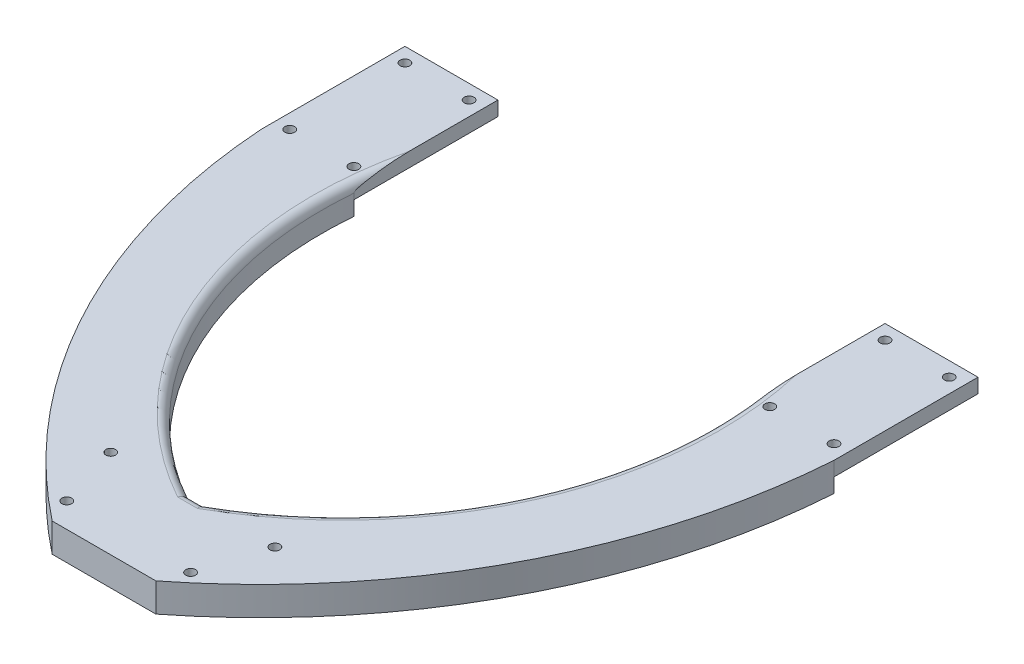
from build123d import *

# Parameters (mm, degrees)
SKIZZE1_W                        = 199
SKIZZE1_H                        = 420
AUFSATZ_LINEAR_AUSTRAGEN1_DEPTH  = 10
SKIZZE5_W                        = 199
SKIZZE5_H                        = 85
SCHNITT_LINEAR_AUSTRAGEN2_DEPTH  = 10
SKIZZE20_R                       = 1.7
SCHNITT_LINEAR_AUSTRAGEN12_DEPTH = 233.594604409
SKIZZE21_W                       = 134.422077922
SKIZZE21_H                       = 75
SCHNITT_LINEAR_AUSTRAGEN13_DEPTH = 233.594604409
SCHNITT_LINEAR_AUSTRAGEN14_DEPTH = 233.594604409
AUFSATZ_LINEAR_AUSTRAGEN6_DEPTH  = 10
SKIZZE25_R                       = 1.7
SCHNITT_LINEAR_AUSTRAGEN15_DEPTH = 233.594604409
SCHNITT_LINEAR_AUSTRAGEN16_DEPTH = 290.484023739
VERRUNDUNG1_R                    = 3
SKIZZE27_R                       = 1.7
SCHNITT_LINEAR_AUSTRAGEN17_DEPTH = 233.594604409
SCHNITT_LINEAR_AUSTRAGEN18_DEPTH = 5


with BuildPart() as part:
    # Skizze1 → Aufsatz-Linear austragen1 (new body)
    with BuildSketch(Plane(origin=(0, 0, 0), x_dir=(1, 0, 0), z_dir=(0, 1, 0))):
        Rectangle(SKIZZE1_W, SKIZZE1_H)
    extrude(amount=AUFSATZ_LINEAR_AUSTRAGEN1_DEPTH)

    # Skizze5 → Schnitt-Linear austragen2 (cut)
    with BuildSketch(Plane(origin=(0, 10, 0), x_dir=(1, 0, 0), z_dir=(0, 1, 0))):
        Polygon((99.5, -210), (18, -210), (99.5, -56), align=None)
        Polygon((-18, -210), (-99.5, -56), (-99.5, -210), align=None)
        with Locations((0, 167.5)):
            Rectangle(SKIZZE5_W, SKIZZE5_H)
        Polygon((67.211038961, -56), (-67.211038961, -56), (-2.646103896, -178), (2.646103896, -178), align=None)
    extrude(amount=-SCHNITT_LINEAR_AUSTRAGEN2_DEPTH, mode=Mode.SUBTRACT)

    # Skizze20 → Schnitt-Linear austragen12 (cut, through all)
    with BuildSketch(Plane(origin=(0, 10, 0), x_dir=(1, 0, 0), z_dir=(0, 1, 0))):
        with Locations(Location((90.5, 119.52, 0), (0, 0, 270))):
            Circle(SKIZZE20_R)
        with Locations(Location((48.5, 119.52, 0), (0, 0, 270))):
            Circle(SKIZZE20_R)
        with Locations(Location((-48.5, 119.52, 0), (0, 0, 90))):
            Circle(SKIZZE20_R)
        with Locations(Location((-90.5, 119.52, 0), (0, 0, 90))):
            Circle(SKIZZE20_R)
        with Locations(Location((87, 43.82, 0), (0, 0, 270))):
            Circle(SKIZZE20_R)
        with Locations(Location((52, 43.82, 0), (0, 0, 270))):
            Circle(SKIZZE20_R)
        with Locations(Location((-87, 43.82, 0), (0, 0, 90))):
            Circle(SKIZZE20_R)
        with Locations(Location((-52, 43.82, 0), (0, 0, 90))):
            Circle(SKIZZE20_R)
    extrude(amount=-SCHNITT_LINEAR_AUSTRAGEN12_DEPTH, mode=Mode.SUBTRACT)

    # Skizze21 → Schnitt-Linear austragen13 (cut, through all)
    with BuildSketch(Plane(origin=(0, 10, 0), x_dir=(1, 0, 0), z_dir=(0, 1, 0))):
        with Locations((0, -18.5)):
            Rectangle(SKIZZE21_W, SKIZZE21_H)
    extrude(amount=-SCHNITT_LINEAR_AUSTRAGEN13_DEPTH, mode=Mode.SUBTRACT)

    # Skizze22 → Schnitt-Linear austragen14 (cut, through all)
    with BuildSketch(Plane(origin=(0, 10, 0), x_dir=(1, 0, 0), z_dir=(0, 1, 0))):
        with BuildLine():
            Line((-67.211038961, -56), (-2.646103896, -178))
            ThreePointArc((-2.646103896, -178), (-52.825886854, -126.471631215), (-67.211038961, -56))
        make_face()
    schnitt_linear_austragen14 = extrude(amount=-SCHNITT_LINEAR_AUSTRAGEN14_DEPTH, mode=Mode.SUBTRACT)

    # Skizze23 → Aufsatz-Linear austragen6 (add)
    with BuildSketch(Plane(origin=(0, 10, 0), x_dir=(1, 0, 0), z_dir=(0, 1, 0))):
        with BuildLine():
            Line((-99.5, -56), (-18, -210))
            ThreePointArc((-18, -210), (-75.095260266, -141.650251374), (-99.5, -56))
        make_face()
    aufsatz_linear_austragen6 = extrude(amount=-AUFSATZ_LINEAR_AUSTRAGEN6_DEPTH)

    # Spiegeln2: Schnitt-Linear austragen14, Aufsatz-Linear austragen6 across plane
    add(schnitt_linear_austragen14.mirror(Plane(origin=(0, 0, 0), x_dir=(0, 0, 1), z_dir=(1, 0, 0))), mode=Mode.SUBTRACT)
    add(aufsatz_linear_austragen6.mirror(Plane(origin=(0, 0, 0), x_dir=(0, 0, 1), z_dir=(1, 0, 0))))

    # Skizze25 → Schnitt-Linear austragen15 (cut, through all)
    with BuildSketch(Plane(origin=(0, 10, 0), x_dir=(1, 0, 0), z_dir=(0, 1, 0))):
        with Locations(Location((-94.5, -11, 0), (0, 0, 270))):
            Circle(SKIZZE25_R)
        with Locations(Location((-72.211038961, -11, 0), (0, 0, 90))):
            Circle(SKIZZE25_R)
        with Locations(Location((-72.211038961, -51, 0), (0, 0, 270))):
            Circle(SKIZZE25_R)
        with Locations(Location((-94.5, -51, 0), (0, 0, 90))):
            Circle(SKIZZE25_R)
    schnitt_linear_austragen15 = extrude(amount=-SCHNITT_LINEAR_AUSTRAGEN15_DEPTH, mode=Mode.SUBTRACT)

    # Spiegeln3: Schnitt-Linear austragen15 across plane
    add(schnitt_linear_austragen15.mirror(Plane(origin=(0, 0, 0), x_dir=(0, 0, 1), z_dir=(1, 0, 0))), mode=Mode.SUBTRACT)

    # Skizze26 → Schnitt-Linear austragen16 (cut, through all)
    with BuildSketch(Plane.ZY.offset(99.5)):
        Polygon((56, 5), (56, 0), (4.196805737, -14.401746423), (-137.707729511, -14.401746423), (-137.707729511, 19.508660812), (5.012761814, 19.508660812), (6, 10), (6, 5), align=None)
    extrude(amount=-SCHNITT_LINEAR_AUSTRAGEN16_DEPTH, mode=Mode.SUBTRACT)

    # Verrundung1
    # the kernel refuses this fillet: 3 mm, written as the material it takes off along each edge
    with BuildSketch(Plane(origin=(60.076908998, 10, 66.721125619), x_dir=(-0.4390500946900349, 0, 0.8984625837243705), z_dir=(0.8984625837243705, 0, 0.4390500946900349))) as verrundung1_piece_1_section:
        with BuildLine():
            CenterArc((127.738655974 + VERRUNDUNG1_R, VERRUNDUNG1_R), VERRUNDUNG1_R, 180, 90)
            Line((127.738655974, VERRUNDUNG1_R), (127.738655974, 0))
            Line((127.738655974, 0), (127.738655974 + VERRUNDUNG1_R, 0))
        make_face()
    verrundung1_piece_1 = revolve(axis=Axis((60.076908998, 10, 66.721125619), (0, -1, 0)), revolution_arc=78.865488706, mode=Mode.PRIVATE)
    verrundung1_piece_1 = split(verrundung1_piece_1, bisect_by=Plane(origin=(60.076908998, 10, 178), z_dir=(0, 0, -1)), keep=Keep.TOP, mode=Mode.PRIVATE)
    add(verrundung1_piece_1, mode=Mode.SUBTRACT)
    with BuildSketch(Plane(origin=(-60.076908998, 10, 66.721125619), x_dir=(0.4390500946900349, 0, 0.8984625837243705), z_dir=(-0.8984625837243705, 0, 0.4390500946900349))) as verrundung1_piece_2_section:
        with BuildLine():
            CenterArc((127.738655974 + VERRUNDUNG1_R, -VERRUNDUNG1_R), VERRUNDUNG1_R, 90, 90)
            Line((127.738655974, -VERRUNDUNG1_R), (127.738655974, 0))
            Line((127.738655974, 0), (127.738655974 + VERRUNDUNG1_R, 0))
        make_face()
    verrundung1_piece_2 = revolve(axis=Axis((-60.076908998, 10, 66.721125619), (0, 1, 0)), revolution_arc=78.865488706, mode=Mode.PRIVATE)
    verrundung1_piece_2 = split(verrundung1_piece_2, bisect_by=Plane(origin=(-60.076908998, 10, 178), z_dir=(0, 0, -1)), keep=Keep.TOP, mode=Mode.PRIVATE)
    add(verrundung1_piece_2, mode=Mode.SUBTRACT)
    with BuildSketch(Plane(origin=(-10.146103896, 10, 178), x_dir=(0, 0, 1), z_dir=(1, 0, 0))) as verrundung1_piece_3_section:
        with BuildLine():
            CenterArc((VERRUNDUNG1_R, VERRUNDUNG1_R), VERRUNDUNG1_R, 180, 90)
            Line((0, VERRUNDUNG1_R), (0, 0))
            Line((0, 0), (VERRUNDUNG1_R, 0))
        make_face()
    verrundung1_piece_3 = extrude(amount=20.292207792, mode=Mode.PRIVATE)
    verrundung1_piece_3 = verrundung1_piece_3 & Plane(origin=(60.076908998, 10, 66.721125619), x_dir=(-0.4910260908528423, 0, 0.8711448663120137), z_dir=(0, 1, 0)) * Cylinder(127.738655974, 53, mode=Mode.PRIVATE)
    verrundung1_piece_3 = verrundung1_piece_3 & Plane(origin=(-60.076908998, 10, 66.721125619), x_dir=(0.4910260908528423, 0, 0.8711448663120137), z_dir=(0, 1, 0)) * Cylinder(127.738655974, 53, mode=Mode.PRIVATE)
    add(verrundung1_piece_3, mode=Mode.SUBTRACT)
    with BuildSketch(Plane(origin=(-10.146103896, 10, 178), x_dir=(0, 0, 1), z_dir=(1, 0, 0))) as verrundung1_piece_4_section:
        with BuildLine():
            CenterArc((VERRUNDUNG1_R, VERRUNDUNG1_R), VERRUNDUNG1_R, 180, 90)
            Line((0, VERRUNDUNG1_R), (0, 0))
            Line((0, 0), (VERRUNDUNG1_R, 0))
        make_face()
    verrundung1_piece_4 = extrude(amount=20.292207792, mode=Mode.PRIVATE)
    verrundung1_piece_4 = verrundung1_piece_4 - Plane(origin=(60.076908998, 10, 66.721125619), x_dir=(-0.4910260908528423, 0, 0.8711448663120137), z_dir=(0, 1, 0)) * Cylinder(127.738655974, 53, mode=Mode.PRIVATE)
    verrundung1_piece_4 = verrundung1_piece_4 - Plane(origin=(-60.076908998, 10, 66.721125619), x_dir=(0.4910260908528423, 0, 0.8711448663120137), z_dir=(0, 1, 0)) * Cylinder(127.738655974, 53, mode=Mode.PRIVATE)
    add(verrundung1_piece_4, mode=Mode.SUBTRACT)
    with BuildSketch(Plane(origin=(60.076908998, 10, 66.721125619), x_dir=(-0.4390500946900349, 0, 0.8984625837243705), z_dir=(0.8984625837243705, 0, 0.4390500946900349))) as verrundung1_piece_5a_section:
        with BuildLine():
            CenterArc((127.738655974 + VERRUNDUNG1_R, VERRUNDUNG1_R), VERRUNDUNG1_R, 180, 90)
            Line((127.738655974, VERRUNDUNG1_R), (127.738655974, 0))
            Line((127.738655974, 0), (127.738655974 + VERRUNDUNG1_R, 0))
        make_face()
    verrundung1_piece_5a = revolve(axis=Axis((60.076908998, 10, 66.721125619), (0, -1, 0)), revolution_arc=78.865488706, mode=Mode.PRIVATE)
    verrundung1_piece_5a = split(verrundung1_piece_5a, bisect_by=Plane(origin=(60.076908998, 10, 178), z_dir=(0, 0, 1)), keep=Keep.TOP, mode=Mode.PRIVATE)
    with BuildSketch(Plane(origin=(-10.146103896, 10, 178), x_dir=(0, 0, 1), z_dir=(1, 0, 0))) as verrundung1_piece_5b_section:
        with BuildLine():
            CenterArc((VERRUNDUNG1_R, VERRUNDUNG1_R), VERRUNDUNG1_R, 180, 90)
            Line((0, VERRUNDUNG1_R), (0, 0))
            Line((0, 0), (VERRUNDUNG1_R, 0))
        make_face()
    verrundung1_piece_5b = extrude(amount=20.292207792, mode=Mode.PRIVATE)
    verrundung1_piece_5b = verrundung1_piece_5b - Plane(origin=(60.076908998, 10, 66.721125619), x_dir=(-0.4910260908528423, 0, 0.8711448663120137), z_dir=(0, 1, 0)) * Cylinder(127.738655974, 53, mode=Mode.PRIVATE)
    verrundung1_piece_5b = verrundung1_piece_5b & Plane(origin=(-60.076908998, 10, 66.721125619), x_dir=(0.4910260908528423, 0, 0.8711448663120137), z_dir=(0, 1, 0)) * Cylinder(127.738655974, 53, mode=Mode.PRIVATE)
    verrundung1_piece_5 = verrundung1_piece_5a & verrundung1_piece_5b
    add(verrundung1_piece_5, mode=Mode.SUBTRACT)
    with BuildSketch(Plane(origin=(-10.146103896, 10, 178), x_dir=(0, 0, 1), z_dir=(1, 0, 0))) as verrundung1_piece_6a_section:
        with BuildLine():
            CenterArc((VERRUNDUNG1_R, VERRUNDUNG1_R), VERRUNDUNG1_R, 180, 90)
            Line((0, VERRUNDUNG1_R), (0, 0))
            Line((0, 0), (VERRUNDUNG1_R, 0))
        make_face()
    verrundung1_piece_6a = extrude(amount=20.292207792, mode=Mode.PRIVATE)
    verrundung1_piece_6a = verrundung1_piece_6a & Plane(origin=(60.076908998, 10, 66.721125619), x_dir=(-0.4910260908528423, 0, 0.8711448663120137), z_dir=(0, 1, 0)) * Cylinder(127.738655974, 53, mode=Mode.PRIVATE)
    verrundung1_piece_6a = verrundung1_piece_6a - Plane(origin=(-60.076908998, 10, 66.721125619), x_dir=(0.4910260908528423, 0, 0.8711448663120137), z_dir=(0, 1, 0)) * Cylinder(127.738655974, 53, mode=Mode.PRIVATE)
    with BuildSketch(Plane(origin=(-60.076908998, 10, 66.721125619), x_dir=(0.4390500946900349, 0, 0.8984625837243705), z_dir=(-0.8984625837243705, 0, 0.4390500946900349))) as verrundung1_piece_6b_section:
        with BuildLine():
            CenterArc((127.738655974 + VERRUNDUNG1_R, -VERRUNDUNG1_R), VERRUNDUNG1_R, 90, 90)
            Line((127.738655974, -VERRUNDUNG1_R), (127.738655974, 0))
            Line((127.738655974, 0), (127.738655974 + VERRUNDUNG1_R, 0))
        make_face()
    verrundung1_piece_6b = revolve(axis=Axis((-60.076908998, 10, 66.721125619), (0, 1, 0)), revolution_arc=78.865488706, mode=Mode.PRIVATE)
    verrundung1_piece_6b = split(verrundung1_piece_6b, bisect_by=Plane(origin=(-60.076908998, 10, 178), z_dir=(0, 0, 1)), keep=Keep.TOP, mode=Mode.PRIVATE)
    verrundung1_piece_6 = verrundung1_piece_6a & verrundung1_piece_6b
    add(verrundung1_piece_6, mode=Mode.SUBTRACT)

    # Skizze27 → Schnitt-Linear austragen17 (cut, through all)
    with BuildSketch(Plane(origin=(0, 10, 0), x_dir=(1, 0, 0), z_dir=(0, 1, 0))):
        with Locations(Location((28.5, -179.171533214, 0), (0, 0, 270))):
            Circle(SKIZZE27_R)
        with Locations(Location((21.5, -201.421972318, 0), (0, 0, 270))):
            Circle(SKIZZE27_R)
        with Locations(Location((-21.5, -201.421972318, 0), (0, 0, 90))):
            Circle(SKIZZE27_R)
        with Locations(Location((-28.5, -179.171533214, 0), (0, 0, 90))):
            Circle(SKIZZE27_R)
    extrude(amount=-SCHNITT_LINEAR_AUSTRAGEN17_DEPTH, mode=Mode.SUBTRACT)

    # Skizze28 → Schnitt-Linear austragen18 (cut)
    with BuildSketch(Plane.XZ):
        Polygon((21.5, 204.828338906), (24.45, 203.125155612), (24.45, 199.718789024), (21.5, 198.01560573), (18.55, 199.718789024), (18.55, 203.125155612), align=None)
        Polygon((28.5, 182.577899803), (31.45, 180.874716508), (31.45, 177.46834992), (28.5, 175.765166626), (25.55, 177.46834992), (25.55, 180.874716508), align=None)
        Polygon((-28.5, 182.577899803), (-25.55, 180.874716508), (-25.55, 177.46834992), (-28.5, 175.765166626), (-31.45, 177.46834992), (-31.45, 180.874716508), align=None)
        Polygon((-21.5, 204.828338906), (-18.55, 203.125155612), (-18.55, 199.718789024), (-21.5, 198.01560573), (-24.45, 199.718789024), (-24.45, 203.125155612), align=None)
    extrude(amount=-SCHNITT_LINEAR_AUSTRAGEN18_DEPTH, mode=Mode.SUBTRACT)


solid = part.part
